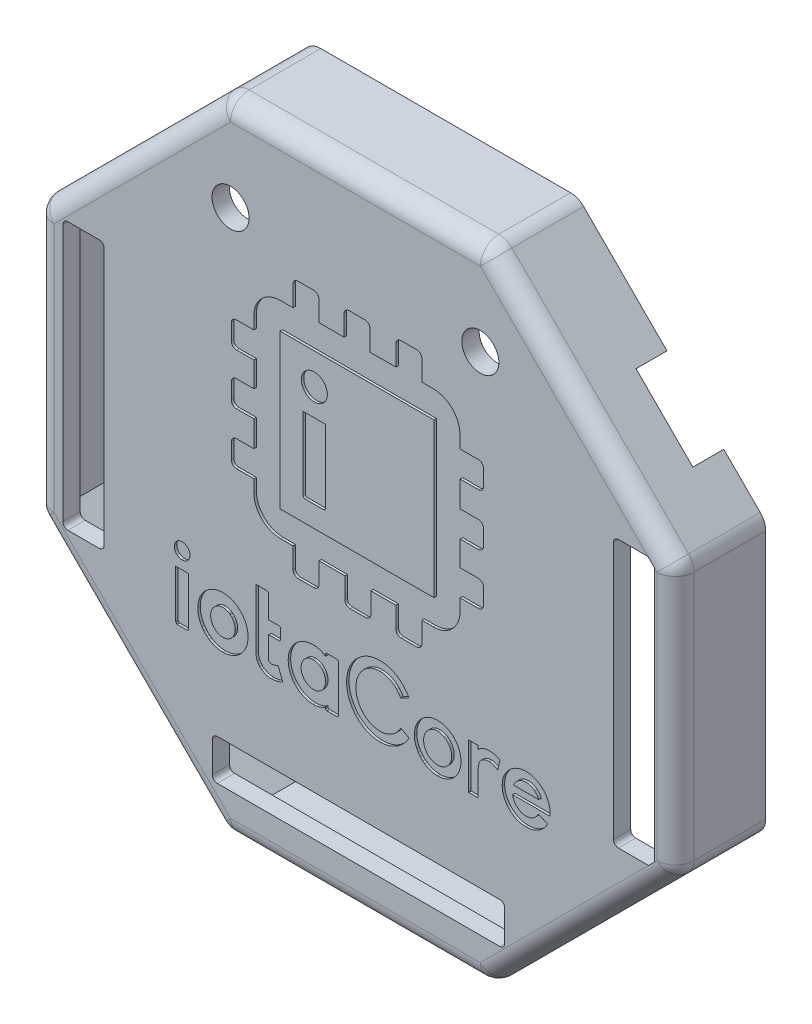
from build123d import *

# Parameters (mm, degrees)
BOSS_EXTRUDE1_DEPTH   = 5
BOSS_EXTRUDE1_2_DEPTH = 5
BOSS_EXTRUDE1_3_DEPTH = 5
BOSS_EXTRUDE1_4_DEPTH = 5
BOSS_EXTRUDE2_DEPTH   = 1.4
BOSS_EXTRUDE3_DEPTH   = 3.4
BOSS_EXTRUDE4_DEPTH   = 3.4
BOSS_EXTRUDE5_DEPTH   = 1
FILLET1_R             = 1.5
CUT_EXTRUDE1_DEPTH    = 38.183060659
CUT_EXTRUDE2_DEPTH    = 38.183060659
SKETCH10_W            = 12.459979079
SKETCH10_H            = 12.459974098
CUT_EXTRUDE3_DEPTH    = 0.2
SKETCH11_R            = 1.5
CUT_EXTRUDE4_DEPTH    = 38.183060659
BOSS_EXTRUDE6_START   = 0.9
BOSS_EXTRUDE6_DEPTH   = 0.9


with BuildPart() as part:
    # Sketch1 → Boss-Extrude1 (new body)
    with BuildSketch(Plane.XY):
        with BuildLine():
            ThreePointArc((25.460660172, -11.167471094), (25.785819299, -10.68083607), (25.9, -10.106810922))
            Line((25.9, -10.106810922), (25.9, 10.106810922))
            ThreePointArc((25.9, 10.106810922), (25.785819299, 10.68083607), (25.460660172, 11.167471094))
            Line((25.460660172, 11.167471094), (22.50588745, 14.122243815))
            Line((22.50588745, 14.122243815), (21.515937957, 13.132294321))
            Line((21.515937957, 13.132294321), (24.5, 10.148232278))
            Line((24.5, 10.148232278), (24.5, -10.148232278))
            Line((24.5, -10.148232278), (21.692714652, -12.955517626))
            Line((21.692714652, -12.955517626), (22.682664146, -13.94546712))
            Line((22.682664146, -13.94546712), (25.460660172, -11.167471094))
        make_face()
    extrude(amount=BOSS_EXTRUDE1_DEPTH)



with BuildPart() as body_2:
    # Sketch1 → Boss-Extrude1 2 (new body)
    with BuildSketch(Plane.XY):
        with BuildLine():
            Line((-15.187332265, -19.460900013), (-16.177281759, -20.450849507))
            Line((-16.177281759, -20.450849507), (-11.167471094, -25.460660172))
            ThreePointArc((-11.167471094, -25.460660172), (-10.68083607, -25.785819299), (-10.106810922, -25.9))
            Line((-10.106810922, -25.9), (10.106810922, -25.9))
            ThreePointArc((10.106810922, -25.9), (10.68083607, -25.785819299), (11.167471094, -25.460660172))
            Line((11.167471094, -25.460660172), (15.611596334, -21.016534932))
            Line((15.611596334, -21.016534932), (14.62164684, -20.026585438))
            Line((14.62164684, -20.026585438), (10.148232278, -24.5))
            Line((10.148232278, -24.5), (-10.148232278, -24.5))
            Line((-10.148232278, -24.5), (-15.187332265, -19.460900013))
        make_face()
    extrude(amount=BOSS_EXTRUDE1_2_DEPTH)


with BuildPart() as body_3:
    # Sketch1 → Boss-Extrude1 3 (new body)
    with BuildSketch(Plane.XY):
        with BuildLine():
            Line((-21.127029227, 13.521203051), (-22.116978721, 14.511152545))
            Line((-22.116978721, 14.511152545), (-25.460660172, 11.167471094))
            ThreePointArc((-25.460660172, 11.167471094), (-25.785819299, 10.68083607), (-25.9, 10.106810922))
            Line((-25.9, 10.106810922), (-25.9, -10.106810922))
            ThreePointArc((-25.9, -10.106810922), (-25.785819299, -10.68083607), (-25.460660172, -11.167471094))
            Line((-25.460660172, -11.167471094), (-22.187689399, -14.440441867))
            Line((-22.187689399, -14.440441867), (-21.197739905, -13.450492373))
            Line((-21.197739905, -13.450492373), (-24.5, -10.148232278))
            Line((-24.5, -10.148232278), (-24.5, 10.148232278))
            Line((-24.5, 10.148232278), (-21.127029227, 13.521203051))
        make_face()
    extrude(amount=BOSS_EXTRUDE1_3_DEPTH)


with BuildPart() as body_4:
    # Sketch1 → Boss-Extrude1 4 (new body)
    with BuildSketch(Plane.XY):
        with BuildLine():
            ThreePointArc((11.167471094, 25.460660172), (10.68083607, 25.785819299), (10.106810922, 25.9))
            Line((10.106810922, 25.9), (-10.106810922, 25.9))
            ThreePointArc((-10.106810922, 25.9), (-10.68083607, 25.785819299), (-11.167471094, 25.460660172))
            Line((-11.167471094, 25.460660172), (-17.520784643, 19.107346623))
            Line((-17.520784643, 19.107346623), (-16.530835149, 18.117397129))
            Line((-16.530835149, 18.117397129), (-10.148232278, 24.5))
            Line((-10.148232278, 24.5), (10.148232278, 24.5))
            Line((10.148232278, 24.5), (16.919743879, 17.728488399))
            Line((16.919743879, 17.728488399), (17.909693373, 18.718437893))
            Line((17.909693373, 18.718437893), (11.167471094, 25.460660172))
        make_face()
    extrude(amount=BOSS_EXTRUDE1_4_DEPTH)


with BuildPart() as part_1:
    add(part.part)

    add(body_2.part)  # Boss-Extrude2 merges body 2

    add(body_3.part)  # Boss-Extrude2 merges body 3

    add(body_4.part)  # Boss-Extrude2 merges body 4
    # Sketch2 → Boss-Extrude2 (add)
    with BuildSketch(Plane.XY.offset(5)):
        with BuildLine():
            Line((25.460660172, 11.167471094), (11.167471094, 25.460660172))
            ThreePointArc((11.167471094, 25.460660172), (10.68083607, 25.785819299), (10.106810922, 25.9))
            Line((10.106810922, 25.9), (-10.106810922, 25.9))
            ThreePointArc((-10.106810922, 25.9), (-10.68083607, 25.785819299), (-11.167471094, 25.460660172))
            Line((-11.167471094, 25.460660172), (-25.460660172, 11.167471094))
            ThreePointArc((-25.460660172, 11.167471094), (-25.785819299, 10.68083607), (-25.9, 10.106810922))
            Line((-25.9, 10.106810922), (-25.9, -10.106810922))
            ThreePointArc((-25.9, -10.106810922), (-25.785819299, -10.68083607), (-25.460660172, -11.167471094))
            Line((-25.460660172, -11.167471094), (-11.167471094, -25.460660172))
            ThreePointArc((-11.167471094, -25.460660172), (-10.68083607, -25.785819299), (-10.106810922, -25.9))
            Line((-10.106810922, -25.9), (10.106810922, -25.9))
            ThreePointArc((10.106810922, -25.9), (10.68083607, -25.785819299), (11.167471094, -25.460660172))
            Line((11.167471094, -25.460660172), (25.460660172, -11.167471094))
            ThreePointArc((25.460660172, -11.167471094), (25.785819299, -10.68083607), (25.9, -10.106810922))
            Line((25.9, -10.106810922), (25.9, 10.106810922))
            ThreePointArc((25.9, 10.106810922), (25.785819299, 10.68083607), (25.460660172, 11.167471094))
        make_face()
    extrude(amount=BOSS_EXTRUDE2_DEPTH)

    # Sketch3 → Boss-Extrude3 (add)
    with BuildSketch(Plane(origin=(0, 0, 5), x_dir=(-1, 0, 0), z_dir=(0, 0, -1))):
        Polygon((-21.515937957, 13.132294321), (-16.919743879, 17.728488399), (-17.909693373, 18.718437893), (-22.50588745, 14.122243815), align=None)
        Polygon((21.127029227, 13.521203051), (16.530835149, 18.117397129), (17.520784643, 19.107346623), (22.116978721, 14.511152545), align=None)
    extrude(amount=BOSS_EXTRUDE3_DEPTH)

    # Sketch4 → Boss-Extrude4 (add)
    with BuildSketch(Plane(origin=(0, 0, 5), x_dir=(-1, 0, 0), z_dir=(0, 0, -1))):
        Polygon((-15.611596334, -21.016534932), (-14.62164684, -20.026585438), (-21.692714652, -12.955517626), (-22.682664146, -13.94546712), align=None)
    extrude(amount=BOSS_EXTRUDE4_DEPTH)

    # Sketch5 → Boss-Extrude5 (add)
    with BuildSketch(Plane(origin=(0, 0, 5), x_dir=(-1, 0, 0), z_dir=(0, 0, -1))):
        Polygon((16.177281759, -20.450849507), (22.187689399, -14.440441867), (21.197739905, -13.450492373), (15.187332265, -19.460900013), align=None)
    extrude(amount=BOSS_EXTRUDE5_DEPTH)

    # Fillet1
    fillet1_edges = [part_1.edges().sort_by_distance(p)[0] for p in [
        (10.68083607, -25.785819299, 6.4),
        (0, -25.9, 6.4),
        (-10.68083607, -25.785819299, 6.4),
        (-18.314065633, -18.314065633, 6.4),
        (-25.785819299, -10.68083607, 6.4),
        (-25.9, 0, 6.4),
        (-25.785819299, 10.68083607, 6.4),
        (-18.314065633, 18.314065633, 6.4),
        (-10.68083607, 25.785819299, 6.4),
        (0, 25.9, 6.4),
        (10.68083607, 25.785819299, 6.4),
        (18.314065633, 18.314065633, 6.4),
        (25.785819299, 10.68083607, 6.4),
        (25.9, 0, 6.4),
        (25.785819299, -10.68083607, 6.4),
        (18.314065633, -18.314065633, 6.4),
        (15.116621587, -20.521560185, 1.6),
        (22.187689399, -13.450492373, 1.6),
    ]]
    fillet(fillet1_edges, radius=FILLET1_R)

    # Sketch6 → Cut-Extrude1 (cut, through all)
    with BuildSketch(Plane.XY.offset(6.4)):
        with BuildLine():
            ThreePointArc((-20.73285457, -10.793999535), (-20.450011859, -10.676842244), (-20.332854575, -10.39399953))
            Line((-20.332854575, -10.39399953), (-20.332854823, 10.43400047))
            ThreePointArc((-20.332854823, 10.43400047), (-20.450012114, 10.716843181), (-20.732854828, 10.834000465))
            Line((-20.732854828, 10.834000465), (-23.272854828, 10.834000435))
            ThreePointArc((-23.272854828, 10.834000435), (-23.555697539, 10.716843144), (-23.672854823, 10.43400043))
            Line((-23.672854823, 10.43400043), (-23.672854575, -10.39399957))
            ThreePointArc((-23.672854575, -10.39399957), (-23.555697284, -10.676842281), (-23.27285457, -10.793999565))
            Line((-23.27285457, -10.793999565), (-20.73285457, -10.793999535))
        make_face()
        with BuildLine():
            ThreePointArc((20.877947301, -10.389000462), (20.995104601, -10.671843169), (21.277947318, -10.789000444))
            Line((21.277947318, -10.789000444), (23.717810584, -10.789000338))
            Line((23.717810584, -10.789000338), (24.217947296, -10.288863626))
            Line((24.217947296, -10.288863626), (24.217946397, 10.288864525))
            Line((24.217946397, 10.288864525), (23.667811262, 10.83899966))
            Line((23.667811262, 10.83899966), (21.277946373, 10.838999556))
            ThreePointArc((21.277946373, 10.838999556), (20.995103665, 10.721842256), (20.87794639, 10.438999538))
            Line((20.87794639, 10.438999538), (20.877947301, -10.389000462))
        make_face()
    extrude(amount=-CUT_EXTRUDE1_DEPTH, mode=Mode.SUBTRACT)

    # Sketch7 → Cut-Extrude2 (cut, through all)
    with BuildSketch(Plane.XY.offset(6.4)):
        with BuildLine():
            ThreePointArc((11.677545073, -22.484597319), (11.960387765, -22.367439982), (12.077545003, -22.084597249))
            Line((12.077545003, -22.084597249), (12.077544568, -19.595397249))
            ThreePointArc((12.077544568, -19.595397249), (11.960387231, -19.312554557), (11.677544498, -19.195397319))
            Line((11.677544498, -19.195397319), (-11.182455502, -19.195401316))
            ThreePointArc((-11.182455502, -19.195401316), (-11.465298194, -19.312558653), (-11.582455432, -19.595401386))
            Line((-11.582455432, -19.595401386), (-11.582454997, -22.084601386))
            ThreePointArc((-11.582454997, -22.084601386), (-11.46529766, -22.367444078), (-11.182454927, -22.484601316))
            Line((-11.182454927, -22.484601316), (11.677545073, -22.484597319))
        make_face()
    extrude(amount=-CUT_EXTRUDE2_DEPTH, mode=Mode.SUBTRACT)

    # Sketch10 → Cut-Extrude3 (cut)
    # profile 1 of 12: a face of its own
    with BuildSketch(Plane.XY.offset(6.4)):
        with BuildLine():
            add(Edge.make_bspline(
                [(9.946665598, 8.667791407), (10.176801961, 8.667791407), (10.363683467, 8.853856031), (10.363683467, 9.083992394)],
                knots=[0, 0, 0, 0, 1, 1, 1, 1], degree=3))
            Line((10.363683467, 9.083992394), (10.363683467, 10.355453088))
            add(Edge.make_bspline(
                [(10.363683467, 10.355453088), (10.363683467, 10.585589451), (10.176801961, 10.771654075), (9.946665598, 10.771654075)],
                knots=[2, 2, 2, 2, 3, 3, 3, 3], degree=3))
            Line((9.946665598, 10.771654075), (8.467921292, 10.771654075))
            Line((8.467921292, 10.771654075), (8.467921292, 11.746058897))
            add(Edge.make_bspline(
                [(8.467921292, 11.746058897), (8.467921292, 12.942441232), (7.497595895, 13.912761649), (6.30040166, 13.912761649)],
                knots=[5, 5, 5, 5, 6, 6, 6, 6], degree=3))
            Line((6.30040166, 13.912761649), (5.37333112, 13.912761649))
            Line((5.37333112, 13.912761649), (5.37333112, 15.558807216))
            add(Edge.make_bspline(
                [(5.37333112, 15.558807216), (5.37333112, 15.788943579), (5.186444633, 15.975825084), (4.95630827, 15.975825084)],
                knots=[8, 8, 8, 8, 9, 9, 9, 9], degree=3))
            Line((4.95630827, 15.975825084), (3.685664458, 15.975825084))
            add(Edge.make_bspline(
                [(3.685664458, 15.975825084), (3.455533076, 15.975825084), (3.268646589, 15.788943579), (3.268646589, 15.558807216)],
                knots=[10, 10, 10, 10, 11, 11, 11, 11], degree=3))
            Line((3.268646589, 15.558807216), (3.268646589, 13.912761649))
            Line((3.268646589, 13.912761649), (1.174576534, 13.912761649))
            Line((1.174576534, 13.912761649), (1.174576534, 15.558807216))
            add(Edge.make_bspline(
                [(1.174576534, 15.558807216), (1.174576534, 15.788943579), (0.988506929, 15.975825084), (0.758370566, 15.975825084)],
                knots=[14, 14, 14, 14, 15, 15, 15, 15], degree=3))
            Line((0.758370566, 15.975825084), (-0.513085147, 15.975825084))
            add(Edge.make_bspline(
                [(-0.513085147, 15.975825084), (-0.74322151, 15.975825084), (-0.929291115, 15.788943579), (-0.929291115, 15.558807216)],
                knots=[16, 16, 16, 16, 17, 17, 17, 17], degree=3))
            Line((-0.929291115, 15.558807216), (-0.929291115, 13.912761649))
            Line((-0.929291115, 13.912761649), (-2.950728475, 13.912761649))
            Line((-2.950728475, 13.912761649), (-2.950728475, 15.558807216))
            add(Edge.make_bspline(
                [(-2.950728475, 15.558807216), (-2.950728475, 15.788943579), (-3.137614961, 15.975825084), (-3.367751324, 15.975825084)],
                knots=[20, 20, 20, 20, 21, 21, 21, 21], degree=3))
            Line((-3.367751324, 15.975825084), (-4.638395137, 15.975825084))
            add(Edge.make_bspline(
                [(-4.638395137, 15.975825084), (-4.868526519, 15.975825084), (-5.055413005, 15.788943579), (-5.055413005, 15.558807216)],
                knots=[22, 22, 22, 22, 23, 23, 23, 23], degree=3))
            Line((-5.055413005, 15.558807216), (-5.055413005, 13.912761649))
            Line((-5.055413005, 13.912761649), (-6.055116241, 13.912761649))
            add(Edge.make_bspline(
                [(-6.055116241, 13.912761649), (-7.252310476, 13.912761649), (-8.222635873, 12.942441232), (-8.222635873, 11.746058897)],
                knots=[25, 25, 25, 25, 26, 26, 26, 26], degree=3))
            Line((-8.222635873, 11.746058897), (-8.222635873, 10.771654075))
            Line((-8.222635873, 10.771654075), (-9.628747484, 10.771654075))
            add(Edge.make_bspline(
                [(-9.628747484, 10.771654075), (-9.858883847, 10.771654075), (-10.045765352, 10.585589451), (-10.045765352, 10.355453088)],
                knots=[28, 28, 28, 28, 29, 29, 29, 29], degree=3))
            Line((-10.045765352, 10.355453088), (-10.045765352, 9.083992394))
            add(Edge.make_bspline(
                [(-10.045765352, 9.083992394), (-10.045765352, 8.853856031), (-9.858883847, 8.667791407), (-9.628747484, 8.667791407)],
                knots=[30, 30, 30, 30, 31, 31, 31, 31], degree=3))
            Line((-9.628747484, 8.667791407), (-8.222635873, 8.667791407))
            Line((-8.222635873, 8.667791407), (-8.222635873, 6.646349066))
            Line((-8.222635873, 6.646349066), (-9.628747484, 6.646349066))
            add(Edge.make_bspline(
                [(-9.628747484, 6.646349066), (-9.858883847, 6.646349066), (-10.045765352, 6.459467561), (-10.045765352, 6.229331198)],
                knots=[34, 34, 34, 34, 35, 35, 35, 35], degree=3))
            Line((-10.045765352, 6.229331198), (-10.045765352, 4.958687385))
            add(Edge.make_bspline(
                [(-10.045765352, 4.958687385), (-10.045765352, 4.728551022), (-9.858883847, 4.541669517), (-9.628747484, 4.541669517)],
                knots=[36, 36, 36, 36, 37, 37, 37, 37], degree=3))
            Line((-9.628747484, 4.541669517), (-8.222635873, 4.541669517))
            Line((-8.222635873, 4.541669517), (-8.222635873, 2.44759448))
            Line((-8.222635873, 2.44759448), (-9.628747484, 2.44759448))
            add(Edge.make_bspline(
                [(-9.628747484, 2.44759448), (-9.858883847, 2.44759448), (-10.045765352, 2.261529856), (-10.045765352, 2.031393493)],
                knots=[40, 40, 40, 40, 41, 41, 41, 41], degree=3))
            Line((-10.045765352, 2.031393493), (-10.045765352, 0.759932799))
            add(Edge.make_bspline(
                [(-10.045765352, 0.759932799), (-10.045765352, 0.529796436), (-9.858883847, 0.343731812), (-9.628747484, 0.343731812)],
                knots=[42, 42, 42, 42, 43, 43, 43, 43], degree=3))
            Line((-9.628747484, 0.343731812), (-8.222635873, 0.343731812))
            Line((-8.222635873, 0.343731812), (-8.222635873, -0.609454022))
            add(Edge.make_bspline(
                [(-8.222635873, -0.609454022), (-8.222635873, -1.806653238), (-7.252310476, -2.776973655), (-6.055116241, -2.776973655)],
                knots=[45, 45, 45, 45, 46, 46, 46, 46], degree=3))
            Line((-6.055116241, -2.776973655), (-5.055413005, -2.776973655))
            Line((-5.055413005, -2.776973655), (-5.055413005, -4.443421329))
            add(Edge.make_bspline(
                [(-5.055413005, -4.443421329), (-5.055413005, -4.673557691), (-4.868526519, -4.860439197), (-4.638395137, -4.860439197)],
                knots=[48, 48, 48, 48, 49, 49, 49, 49], degree=3))
            Line((-4.638395137, -4.860439197), (-3.367751324, -4.860439197))
            add(Edge.make_bspline(
                [(-3.367751324, -4.860439197), (-3.137614961, -4.860439197), (-2.950728475, -4.673557691), (-2.950728475, -4.443421329)],
                knots=[50, 50, 50, 50, 51, 51, 51, 51], degree=3))
            Line((-2.950728475, -4.443421329), (-2.950728475, -2.776973655))
            Line((-2.950728475, -2.776973655), (-0.856658419, -2.776973655))
            Line((-0.856658419, -2.776973655), (-0.856658419, -4.443421329))
            add(Edge.make_bspline(
                [(-0.856658419, -4.443421329), (-0.856658419, -4.673557691), (-0.669776914, -4.860439197), (-0.439640551, -4.860439197)],
                knots=[54, 54, 54, 54, 55, 55, 55, 55], degree=3))
            Line((-0.439640551, -4.860439197), (0.831003261, -4.860439197))
            add(Edge.make_bspline(
                [(0.831003261, -4.860439197), (1.061139624, -4.860439197), (1.24802113, -4.673557691), (1.24802113, -4.443421329)],
                knots=[56, 56, 56, 56, 57, 57, 57, 57], degree=3))
            Line((1.24802113, -4.443421329), (1.24802113, -2.776973655))
            Line((1.24802113, -2.776973655), (3.268646589, -2.776973655))
            Line((3.268646589, -2.776973655), (3.268646589, -4.443421329))
            add(Edge.make_bspline(
                [(3.268646589, -4.443421329), (3.268646589, -4.673557691), (3.455533076, -4.860439197), (3.685664458, -4.860439197)],
                knots=[60, 60, 60, 60, 61, 61, 61, 61], degree=3))
            Line((3.685664458, -4.860439197), (4.95630827, -4.860439197))
            add(Edge.make_bspline(
                [(4.95630827, -4.860439197), (5.186444633, -4.860439197), (5.37333112, -4.673557691), (5.37333112, -4.443421329)],
                knots=[62, 62, 62, 62, 63, 63, 63, 63], degree=3))
            Line((5.37333112, -4.443421329), (5.37333112, -2.776973655))
            Line((5.37333112, -2.776973655), (6.30040166, -2.776973655))
            add(Edge.make_bspline(
                [(6.30040166, -2.776973655), (7.497595895, -2.776973655), (8.467921292, -1.806653238), (8.467921292, -0.609454022)],
                knots=[65, 65, 65, 65, 66, 66, 66, 66], degree=3))
            Line((8.467921292, -0.609454022), (8.467921292, 0.343731812))
            Line((8.467921292, 0.343731812), (9.946665598, 0.343731812))
            add(Edge.make_bspline(
                [(9.946665598, 0.343731812), (10.176801961, 0.343731812), (10.363683467, 0.529796436), (10.363683467, 0.759932799)],
                knots=[68, 68, 68, 68, 69, 69, 69, 69], degree=3))
            Line((10.363683467, 0.759932799), (10.363683467, 2.031393493))
            add(Edge.make_bspline(
                [(10.363683467, 2.031393493), (10.363683467, 2.261529856), (10.176801961, 2.44759448), (9.946665598, 2.44759448)],
                knots=[70, 70, 70, 70, 71, 71, 71, 71], degree=3))
            Line((9.946665598, 2.44759448), (8.467921292, 2.44759448))
            Line((8.467921292, 2.44759448), (8.467921292, 4.469036821))
            Line((8.467921292, 4.469036821), (9.946665598, 4.469036821))
            add(Edge.make_bspline(
                [(9.946665598, 4.469036821), (10.176801961, 4.469036821), (10.363683467, 4.655918326), (10.363683467, 4.886054689)],
                knots=[74, 74, 74, 74, 75, 75, 75, 75], degree=3))
            Line((10.363683467, 4.886054689), (10.363683467, 6.156698502))
            add(Edge.make_bspline(
                [(10.363683467, 6.156698502), (10.363683467, 6.386834865), (10.176801961, 6.57371637), (9.946665598, 6.57371637)],
                knots=[76, 76, 76, 76, 77, 77, 77, 77], degree=3))
            Line((9.946665598, 6.57371637), (8.467921292, 6.57371637))
            Line((8.467921292, 6.57371637), (8.467921292, 8.667791407))
            Line((8.467921292, 8.667791407), (9.946665598, 8.667791407))
        make_face()
        with Locations((0.12264271, 5.520968155)):
            Rectangle(SKETCH10_W, SKETCH10_H, mode=Mode.SUBTRACT)
    # profile 2 of 12: a face of its own
    with BuildSketch(Plane.XY.offset(6.4)):
        with BuildLine():
            Line((-2.412114846, 1.17858443), (-2.412114846, 7.057653747))
            Line((-2.412114846, 7.057653747), (-4.2458588, 7.057653747))
            Line((-4.2458588, 7.057653747), (-4.2458588, 1.17858443))
            add(Edge.make_bspline(
                [(-4.06386862, 0.996599231), (-4.164250373, 0.996599231), (-4.2458588, 1.078207659), (-4.2458588, 1.17858443)],
                knots=[3, 3, 3, 3, 4, 4, 4, 4], degree=3))
            Line((-4.06386862, 0.996599231), (-2.594916927, 0.996599231))
            add(Edge.make_bspline(
                [(-2.412114846, 1.17858443), (-2.412114846, 1.078207659), (-2.493723274, 0.996599231), (-2.594916927, 0.996599231)],
                knots=[1, 1, 1, 1, 2, 2, 2, 2], degree=3))
        make_face()
    # profile 3 of 12: a face of its own
    with BuildSketch(Plane.XY.offset(6.4)):
        Polygon((-13.49768684, -8.945545649), (-14.542354809, -8.945545649), (-14.542354809, -12.819764399), (-14.538487621, -12.882694087), (-14.454991527, -12.968123774), (-13.645870434, -12.968123774), (-13.582237621, -12.964256587), (-13.49768684, -12.879881587), align=None)
    # profile 4 of 12: a face of its own
    with BuildSketch(Plane.XY.offset(6.4)):
        with BuildLine():
            Line((-13.384835277, -7.620506587), (-13.384835277, -7.596951899))
            add(Edge.make_bspline(
                [(-13.577667309, -7.149412837), (-13.449698559, -7.280897212), (-13.384659496, -7.431365962), (-13.384835277, -7.596951899)],
                knots=[17, 17, 17, 17, 18, 18, 18, 18], degree=3))
            Line((-13.577667309, -7.149412837), (-13.586104809, -7.141326899))
            add(Edge.make_bspline(
                [(-14.004464184, -6.973280024), (-13.85487434, -6.973280024), (-13.71424934, -7.029881587), (-13.586104809, -7.141326899)],
                knots=[15, 15, 15, 15, 16, 16, 16, 16], degree=3))
            Line((-14.004464184, -6.973280024), (-14.035753246, -6.973280024))
            add(Edge.make_bspline(
                [(-14.38784309, -7.086834712), (-14.273409496, -7.011600337), (-14.154932934, -6.973280024), (-14.035753246, -6.973280024)],
                knots=[13, 13, 13, 13, 14, 14, 14, 14], degree=3))
            Line((-14.38784309, -7.086834712), (-14.461495434, -7.149061274))
            Line((-14.461495434, -7.149061274), (-14.472921215, -7.159959712))
            add(Edge.make_bspline(
                [(-14.655557934, -7.593084712), (-14.655557934, -7.436639399), (-14.594034496, -7.291092524), (-14.472921215, -7.159959712)],
                knots=[10, 10, 10, 10, 11, 11, 11, 11], degree=3))
            Line((-14.655557934, -7.593084712), (-14.655557934, -7.624373774))
            add(Edge.make_bspline(
                [(-14.601944652, -7.866248774), (-14.636925121, -7.786795649), (-14.655557934, -7.704178462), (-14.655557934, -7.624373774)],
                knots=[8, 8, 8, 8, 9, 9, 9, 9], degree=3))
            add(Edge.make_bspline(
                [(-14.463604809, -8.063123774), (-14.531456371, -7.991756587), (-14.576632152, -7.927420649), (-14.601944652, -7.866248774)],
                knots=[7, 7, 7, 7, 8, 8, 8, 8], degree=3))
            Line((-14.463604809, -8.063123774), (-14.456925121, -8.069803462))
            add(Edge.make_bspline(
                [(-14.031886059, -8.244178462), (-14.188331371, -8.244178462), (-14.331241527, -8.185467524), (-14.456925121, -8.069803462)],
                knots=[5, 5, 5, 5, 6, 6, 6, 6], degree=3))
            Line((-14.031886059, -8.244178462), (-14.008507152, -8.244178462))
            add(Edge.make_bspline(
                [(-13.56096809, -8.051170649), (-13.692276684, -8.179139399), (-13.842921215, -8.244178462), (-14.008507152, -8.244178462)],
                knots=[3, 3, 3, 3, 4, 4, 4, 4], degree=3))
            Line((-13.56096809, -8.051170649), (-13.552882152, -8.042733149))
            add(Edge.make_bspline(
                [(-13.384835277, -7.620506587), (-13.384835277, -7.772381587), (-13.441261059, -7.914412837), (-13.552882152, -8.042733149)],
                knots=[1, 1, 1, 1, 2, 2, 2, 2], degree=3))
        make_face()
    # profile 5 of 12: a face of its own
    with BuildSketch(Plane.XY.offset(6.4)):
        with BuildLine():
            Line((-10.740382152, -13.061639399), (-10.705225902, -13.061639399))
            add(Edge.make_bspline(
                [(-9.662139965, -12.759295649), (-9.994542309, -12.960389399), (-10.34487434, -13.061639399), (-10.705225902, -13.061639399)],
                knots=[4, 4, 4, 4, 5, 5, 5, 5], degree=3))
            add(Edge.make_bspline(
                [(-9.45331184, -12.607772212), (-9.523096996, -12.665076899), (-9.594815746, -12.717108149), (-9.662139965, -12.759295649)],
                knots=[3, 3, 3, 3, 4, 4, 4, 4], degree=3))
            add(Edge.make_bspline(
                [(-9.181554027, -12.337069087), (-9.294581371, -12.467498774), (-9.382120434, -12.554686274), (-9.45331184, -12.607772212)],
                knots=[2, 2, 2, 2, 3, 3, 3, 3], degree=3))
            add(Edge.make_bspline(
                [(-8.944425121, -11.990428462), (-9.004190746, -12.098709712), (-9.08346809, -12.214373774), (-9.181554027, -12.337069087)],
                knots=[1, 1, 1, 1, 2, 2, 2, 2], degree=3))
            add(Edge.make_bspline(
                [(-8.690069652, -10.980037837), (-8.690069652, -11.329490962), (-8.775675121, -11.669451899), (-8.944425121, -11.990428462)],
                knots=[0, 0, 0, 0, 1, 1, 1, 1], degree=3))
            add(Edge.make_bspline(
                [(-8.835089184, -10.202733149), (-8.739464184, -10.448475337), (-8.690421215, -10.711444087), (-8.690069652, -10.980037837)],
                knots=[24, 24, 24, 24, 25, 25, 25, 25], degree=3))
            add(Edge.make_bspline(
                [(-9.245538402, -9.539334712), (-9.054464184, -9.752381587), (-8.916475902, -9.975623774), (-8.835089184, -10.202733149)],
                knots=[23, 23, 23, 23, 24, 24, 24, 24], degree=3))
            Line((-9.245538402, -9.539334712), (-9.249581371, -9.535115962))
            add(Edge.make_bspline(
                [(-9.474757152, -9.326990962), (-9.421319652, -9.366365962), (-9.346612621, -9.435272212), (-9.249581371, -9.535115962)],
                knots=[21, 21, 21, 21, 22, 22, 22, 22], degree=3))
            add(Edge.make_bspline(
                [(-9.474757152, -9.326990962), (-9.84987434, -9.035194087), (-10.270518871, -8.887186274), (-11.132198559, -8.887186274), (-11.512237621, -9.005662837), (-11.849210277, -9.235936274)],
                knots=[20, 20, 20, 20, 21, 21, 21.896324952, 21.896324952, 21.896324952, 21.896324952], degree=3))
            add(Edge.make_bspline(
                [(-12.143819652, -9.478865962), (-12.006710277, -9.352655024), (-11.913194652, -9.275662837), (-11.849210277, -9.235936274)],
                knots=[18, 18, 18, 18, 19, 19, 19, 19], degree=3))
            Line((-12.143819652, -9.478865962), (-12.152432934, -9.487303462))
            add(Edge.make_bspline(
                [(-12.363897777, -9.740780024), (-12.314679027, -9.671522212), (-12.245948559, -9.588905024), (-12.152432934, -9.487303462)],
                knots=[16, 16, 16, 16, 17, 17, 17, 17], degree=3))
            add(Edge.make_bspline(
                [(-12.522276684, -10.004100337), (-12.477452465, -9.916912837), (-12.424366527, -9.829022212), (-12.363897777, -9.740780024)],
                knots=[15, 15, 15, 15, 16, 16, 16, 16], degree=3))
            add(Edge.make_bspline(
                [(-12.755538402, -10.945233149), (-12.755538402, -10.633045649), (-12.677139965, -10.316287837), (-12.522276684, -10.004100337)],
                knots=[14, 14, 14, 14, 15, 15, 15, 15], degree=3))
            Line((-12.755538402, -10.945233149), (-12.755538402, -11.003592524))
            add(Edge.make_bspline(
                [(-12.558839184, -11.871248774), (-12.689620434, -11.582264399), (-12.755538402, -11.290819087), (-12.755538402, -11.003592524)],
                knots=[12, 12, 12, 12, 13, 13, 13, 13], degree=3))
            add(Edge.make_bspline(
                [(-12.416983715, -12.129998774), (-12.472706371, -12.041053462), (-12.520167309, -11.954217524), (-12.558839184, -11.871248774)],
                knots=[11, 11, 11, 11, 12, 12, 12, 12], degree=3))
            add(Edge.make_bspline(
                [(-12.25596809, -12.345506587), (-12.31362434, -12.279061274), (-12.367764965, -12.206639399), (-12.416983715, -12.129998774)],
                knots=[10, 10, 10, 10, 11, 11, 11, 11], degree=3))
            add(Edge.make_bspline(
                [(-12.01831184, -12.583162837), (-12.126944652, -12.491405024), (-12.204815746, -12.413358149), (-12.25596809, -12.345506587)],
                knots=[9, 9, 9, 9, 10, 10, 10, 10], degree=3))
            add(Edge.make_bspline(
                [(-11.844112621, -12.720975337), (-11.908975902, -12.672459712), (-11.966983715, -12.626405024), (-12.01831184, -12.583162837)],
                knots=[8, 8, 8, 8, 9, 9, 9, 9], degree=3))
            Line((-11.844112621, -12.720975337), (-11.835323559, -12.726951899))
            add(Edge.make_bspline(
                [(-10.740382152, -13.061639399), (-11.120245434, -13.061639399), (-11.488682934, -12.949139399), (-11.835323559, -12.726951899)],
                knots=[6, 6, 6, 6, 7, 7, 7, 7], degree=3))
        make_face()
        with BuildLine():
            Line((-10.15503059, -10.127850337), (-10.13534309, -10.136287837))
            add(Edge.make_bspline(
                [(-10.004210277, -10.259686274), (-10.099659496, -10.158436274), (-10.131827465, -10.138045649), (-10.13534309, -10.136287837)],
                knots=[0, 0, 0, 0, 1, 1, 1, 1], degree=3))
            add(Edge.make_bspline(
                [(-9.731046215, -10.972303462), (-9.731046215, -10.706873774), (-9.82034309, -10.473787837), (-10.004210277, -10.259686274)],
                knots=[17, 17, 17, 17, 18, 18, 18, 18], degree=3))
            Line((-9.731046215, -10.972303462), (-9.731046215, -10.984256587))
            add(Edge.make_bspline(
                [(-9.874483715, -11.514061274), (-9.778682934, -11.340740962), (-9.731046215, -11.163553462), (-9.731046215, -10.984256587)],
                knots=[15, 15, 15, 15, 16, 16, 16, 16], degree=3))
            add(Edge.make_bspline(
                [(-10.038487621, -11.726756587), (-9.961143871, -11.644842524), (-9.90471809, -11.572069087), (-9.874483715, -11.514061274)],
                knots=[14, 14, 14, 14, 15, 15, 15, 15], degree=3))
            add(Edge.make_bspline(
                [(-10.038487621, -11.726756587), (-10.24081184, -11.924686274), (-10.465460277, -12.020662837), (-10.936202465, -12.020662837), (-11.126925121, -11.953865962), (-11.307979809, -11.816405024)],
                knots=[13, 13, 13, 13, 14, 14, 14.814363144, 14.814363144, 14.814363144, 14.814363144], degree=3))
            Line((-11.307979809, -11.816405024), (-11.317120434, -11.810076899))
            add(Edge.make_bspline(
                [(-11.469522777, -11.662069087), (-11.380753246, -11.761912837), (-11.335577465, -11.798123774), (-11.317120434, -11.810076899)],
                knots=[10, 10, 10, 10, 11, 11, 11, 11], degree=3))
            add(Edge.make_bspline(
                [(-11.469522777, -11.662069087), (-11.634581371, -11.454998774), (-11.714913402, -11.232108149), (-11.714913402, -10.746248774), (-11.649698559, -10.541639399), (-11.515753246, -10.354959712)],
                knots=[9, 9, 9, 9, 10, 10, 10.927475593, 10.927475593, 10.927475593, 10.927475593], degree=3))
            Line((-11.515753246, -10.354959712), (-11.505557934, -10.338436274))
            add(Edge.make_bspline(
                [(-11.384620434, -10.198865962), (-11.477081371, -10.291326899), (-11.500636059, -10.329295649), (-11.505557934, -10.338436274)],
                knots=[6, 6, 6, 6, 7, 7, 7, 7], degree=3))
            add(Edge.make_bspline(
                [(-11.384620434, -10.198865962), (-11.18159309, -10.016405024), (-10.965733715, -9.927811274), (-10.568116527, -9.927811274), (-10.413956371, -9.967889399), (-10.266827465, -10.046990962)],
                knots=[5, 5, 5, 5, 6, 6, 6.651094891, 6.651094891, 6.651094891, 6.651094891], degree=3))
            add(Edge.make_bspline(
                [(-10.165753246, -10.117303462), (-10.202139965, -10.087069087), (-10.236241527, -10.063514399), (-10.266827465, -10.046990962)],
                knots=[3, 3, 3, 3, 4, 4, 4, 4], degree=3))
            Line((-10.165753246, -10.117303462), (-10.15503059, -10.127850337))
        make_face(mode=Mode.SUBTRACT)
    # profile 6 of 12: a face of its own
    with BuildSketch(Plane.XY.offset(6.4)):
        with BuildLine():
            Line((-6.00378059, -12.793045649), (-5.873702465, -12.738201899))
            Line((-5.873702465, -12.738201899), (-6.263057934, -11.757342524))
            Line((-6.263057934, -11.757342524), (-6.427589184, -11.837498774))
            add(Edge.make_bspline(
                [(-6.427589184, -11.837498774), (-6.634659496, -11.911678462), (-6.746632152, -11.927147212), (-6.852628246, -11.927147212), (-6.899386059, -11.914842524), (-6.950362621, -11.887420649)],
                knots=[25, 25, 25, 25, 26, 26, 26.838414634, 26.838414634, 26.838414634, 26.838414634], degree=3))
            add(Edge.make_bspline(
                [(-7.018741527, -11.724295649), (-7.018741527, -11.853319087), (-6.970753246, -11.877225337), (-6.950362621, -11.887420649)],
                knots=[23, 23, 23, 23, 24, 24, 24, 24], degree=3))
            Line((-7.018741527, -11.724295649), (-7.018741527, -9.986522212))
            Line((-7.018741527, -9.986522212), (-6.195382152, -9.986522212))
            Line((-6.195382152, -9.986522212), (-6.131925121, -9.982655024))
            Line((-6.131925121, -9.982655024), (-6.04737434, -9.897928462))
            Line((-6.04737434, -9.897928462), (-6.04737434, -9.090037837))
            Line((-6.04737434, -9.090037837), (-6.051241527, -9.026053462))
            Line((-6.051241527, -9.026053462), (-6.136143871, -8.942030024))
            Line((-6.136143871, -8.942030024), (-7.018741527, -8.942030024))
            Line((-7.018741527, -8.942030024), (-7.018741527, -7.121287837))
            Line((-7.018741527, -7.121287837), (-7.022608715, -7.057655024))
            Line((-7.022608715, -7.057655024), (-7.107159496, -6.973280024))
            Line((-7.107159496, -6.973280024), (-8.059366527, -6.973280024))
            Line((-8.059366527, -6.973280024), (-8.059366527, -11.752069087))
            add(Edge.make_bspline(
                [(-7.941241527, -12.285740962), (-8.019639965, -12.108553462), (-8.059366527, -11.928905024), (-8.059366527, -11.752069087)],
                knots=[9, 9, 9, 9, 10, 10, 10, 10], degree=3))
            add(Edge.make_bspline(
                [(-7.826632152, -12.474881587), (-7.874971996, -12.411951899), (-7.91346809, -12.348319087), (-7.941241527, -12.285740962)],
                knots=[8, 8, 8, 8, 9, 9, 9, 9], degree=3))
            Line((-7.826632152, -12.474881587), (-7.760362621, -12.561365962))
            Line((-7.760362621, -12.561365962), (-7.745421215, -12.577889399))
            add(Edge.make_bspline(
                [(-7.58440559, -12.715701899), (-7.627823559, -12.684764399), (-7.680206371, -12.640115962), (-7.745421215, -12.577889399)],
                knots=[5, 5, 5, 5, 6, 6, 6, 6], degree=3))
            add(Edge.make_bspline(
                [(-6.80815559, -12.967772212), (-7.084659496, -12.967772212), (-7.345694652, -12.883045649), (-7.58440559, -12.715701899)],
                knots=[4, 4, 4, 4, 5, 5, 5, 5], degree=3))
            Line((-6.80815559, -12.967772212), (-6.800421215, -12.967772212))
            add(Edge.make_bspline(
                [(-6.32299934, -12.899569087), (-6.50299934, -12.945272212), (-6.66190559, -12.967772212), (-6.800421215, -12.967772212)],
                knots=[2, 2, 2, 2, 3, 3, 3, 3], degree=3))
            add(Edge.make_bspline(
                [(-6.00378059, -12.793045649), (-6.069522777, -12.820819087), (-6.17393684, -12.855623774), (-6.32299934, -12.899569087)],
                knots=[1, 1, 1, 1, 2, 2, 2, 2], degree=3))
        make_face()
    # profile 7 of 12: a face of its own
    with BuildSketch(Plane.XY.offset(6.4)):
        with BuildLine():
            Line((-1.377042309, -12.876014399), (-1.377042309, -9.038006587))
            Line((-1.377042309, -9.038006587), (-1.469151684, -8.945545649))
            Line((-1.469151684, -8.945545649), (-2.309034496, -8.945545649))
            Line((-2.309034496, -8.945545649), (-2.421534496, -9.020076899))
            Line((-2.421534496, -9.020076899), (-2.421534496, -9.203944087))
            add(Edge.make_bspline(
                [(-2.421534496, -9.203944087), (-2.704893871, -8.993358149), (-3.030089184, -8.887186274), (-3.887022777, -8.887186274), (-4.336495434, -9.053123774), (-4.734112621, -9.386405024)],
                knots=[11, 11, 11, 11, 12, 12, 13.367654201, 13.367654201, 13.367654201, 13.367654201], degree=3))
            add(Edge.make_bspline(
                [(-4.734112621, -9.386405024), (-5.203975902, -9.828319087), (-5.442159496, -10.361990962), (-5.442159496, -11.470115962), (-5.282022777, -11.921522212), (-4.962804027, -12.321951899)],
                knots=[9, 9, 9, 9, 10, 10, 10.803203661, 10.803203661, 10.803203661, 10.803203661], degree=3))
            add(Edge.make_bspline(
                [(-3.40362434, -13.061639399), (-4.01393684, -13.061639399), (-4.53846809, -12.812733149), (-4.962804027, -12.321951899)],
                knots=[7, 7, 7, 7, 8, 8, 8, 8], degree=3))
            Line((-3.40362434, -13.061639399), (-3.399757152, -13.061639399))
            add(Edge.make_bspline(
                [(-2.421534496, -12.761053462), (-2.696456371, -12.960740962), (-3.024112621, -13.061639399), (-3.399757152, -13.061639399)],
                knots=[5, 5, 5, 5, 6, 6, 6, 6], degree=3))
            Line((-2.421534496, -12.761053462), (-2.421534496, -12.893592524))
            Line((-2.421534496, -12.893592524), (-2.309034496, -12.968123774))
            Line((-2.309034496, -12.968123774), (-1.469151684, -12.968123774))
            Line((-1.469151684, -12.968123774), (-1.377042309, -12.876014399))
        make_face()
        with BuildLine():
            Line((-3.446690746, -9.931678462), (-3.384288402, -9.931678462))
            add(Edge.make_bspline(
                [(-2.887354809, -10.087069087), (-3.056807934, -9.984061274), (-3.224151684, -9.931678462), (-3.384288402, -9.931678462)],
                knots=[0, 0, 0, 0, 1, 1, 1, 1], degree=3))
            add(Edge.make_bspline(
                [(-2.887354809, -10.087069087), (-2.573761059, -10.314530024), (-2.421534496, -10.604217524), (-2.421534496, -11.275701899), (-2.526651684, -11.529530024), (-2.742511059, -11.752069087)],
                knots=[9, 9, 9, 9, 10, 10, 10.803588291, 10.803588291, 10.803588291, 10.803588291], degree=3))
            add(Edge.make_bspline(
                [(-3.368643871, -12.017147212), (-3.154542309, -12.017147212), (-2.949581371, -11.930311274), (-2.742511059, -11.752069087)],
                knots=[7, 7, 7, 7, 8, 8, 8, 8], degree=3))
            Line((-3.368643871, -12.017147212), (-3.454425121, -12.017147212))
            add(Edge.make_bspline(
                [(-3.93518684, -11.862108149), (-3.76362434, -11.964764399), (-3.60190559, -12.017147212), (-3.454425121, -12.017147212)],
                knots=[5, 5, 5, 5, 6, 6, 6, 6], degree=3))
            add(Edge.make_bspline(
                [(-3.93518684, -11.862108149), (-4.248956371, -11.626912837), (-4.401534496, -11.336170649), (-4.401534496, -10.740623774), (-4.328761059, -10.523709712), (-4.178819652, -10.309608149)],
                knots=[4, 4, 4, 4, 5, 5, 5.636714976, 5.636714976, 5.636714976, 5.636714976], degree=3))
            add(Edge.make_bspline(
                [(-3.446690746, -9.931678462), (-3.715460277, -9.931678462), (-3.95487434, -10.055428462), (-4.178819652, -10.309608149)],
                knots=[2, 2, 2, 2, 3, 3, 3, 3], degree=3))
        make_face(mode=Mode.SUBTRACT)
    # profile 8 of 12: a face of its own
    with BuildSketch(Plane.XY.offset(6.4)):
        with BuildLine():
            Line((4.333092679, -11.55291986), (4.333092679, -11.537099547))
            Line((4.333092679, -11.537099547), (3.674616116, -11.190458922))
            add(Edge.make_bspline(
                [(3.316022366, -11.677724547), (3.484772366, -11.490693297), (3.604303616, -11.328271422), (3.674616116, -11.190458922)],
                knots=[20, 20, 20, 20, 21, 21, 21, 21], degree=3))
            add(Edge.make_bspline(
                [(2.033522366, -12.242685485), (2.490905179, -12.242685485), (2.918405179, -12.054247985), (3.316022366, -11.677724547)],
                knots=[19, 19, 19, 19, 20, 20, 20, 20], degree=3))
            Line((2.033522366, -12.242685485), (1.951608304, -12.242685485))
            add(Edge.make_bspline(
                [(0.770709866, -11.79057611), (1.141959866, -12.092216735), (1.535709866, -12.242685485), (1.951608304, -12.242685485)],
                knots=[17, 17, 17, 17, 18, 18, 18, 18], degree=3))
            add(Edge.make_bspline(
                [(0.770709866, -11.79057611), (0.279752835, -11.336005797), (0.034010648, -10.78651361), (0.034010648, -9.585927672), (0.226315335, -9.090927672), (0.61092471, -8.656747985)],
                knots=[16, 16, 16, 16, 17, 17, 17.862050164, 17.862050164, 17.862050164, 17.862050164], degree=3))
            add(Edge.make_bspline(
                [(0.61092471, -8.656747985), (1.010827054, -8.246122985), (1.469616116, -8.041162047), (2.495827054, -8.041162047), (2.952155179, -8.243662047), (3.355045804, -8.64901361)],
                knots=[14, 14, 14, 14, 15, 15, 15.984364378, 15.984364378, 15.984364378, 15.984364378], degree=3))
            add(Edge.make_bspline(
                [(3.670748929, -9.089521422), (3.600436429, -8.962255797), (3.495319241, -8.815302672), (3.355045804, -8.64901361)],
                knots=[12, 12, 12, 12, 13, 13, 13, 13], degree=3))
            add(Edge.make_bspline(
                [(4.329225491, -8.727060485), (4.308483304, -8.745341735), (4.089108304, -8.865927672), (3.670748929, -9.089521422)],
                knots=[11, 11, 11, 11, 12, 12, 12, 12], degree=3))
            add(Edge.make_bspline(
                [(3.916139554, -8.150146422), (4.110905179, -8.373740172), (4.248717679, -8.565693297), (4.329225491, -8.727060485)],
                knots=[10, 10, 10, 10, 11, 11, 11, 11], degree=3))
            add(Edge.make_bspline(
                [(1.986764554, -7.292685485), (2.722233304, -7.292685485), (3.365241116, -7.578505797), (3.916139554, -8.150146422)],
                knots=[9, 9, 9, 9, 10, 10, 10, 10], degree=3))
            Line((1.986764554, -7.292685485), (1.979030179, -7.292685485))
            add(Edge.make_bspline(
                [(0.010807523, -8.196904235), (0.572252835, -7.593974547), (1.228092679, -7.292685485), (1.979030179, -7.292685485)],
                knots=[7, 7, 7, 7, 8, 8, 8, 8], degree=3))
            add(Edge.make_bspline(
                [(-0.714114352, -10.13401361), (-0.714114352, -9.414365172), (-0.472590915, -8.76854486), (0.010807523, -8.196904235)],
                knots=[6, 6, 6, 6, 7, 7, 7, 7], degree=3))
            Line((-0.714114352, -10.13401361), (-0.714114352, -10.157216735))
            add(Edge.make_bspline(
                [(-0.00079404, -12.086943297), (-0.476458102, -11.512490172), (-0.714114352, -10.86948236), (-0.714114352, -10.157216735)],
                knots=[4, 4, 4, 4, 5, 5, 5, 5], degree=3))
            add(Edge.make_bspline(
                [(-0.00079404, -12.086943297), (0.565573148, -12.69479486), (1.228092679, -12.998896422), (2.750709866, -12.998896422), (3.415866116, -12.689521422), (3.982233304, -12.071122985)],
                knots=[3, 3, 3, 3, 4, 4, 5.00695088, 5.00695088, 5.00695088, 5.00695088], degree=3))
            add(Edge.make_bspline(
                [(4.333092679, -11.55291986), (4.244850491, -11.716396422), (4.127780179, -11.889365172), (3.982233304, -12.071122985)],
                knots=[1, 1, 1, 1, 2, 2, 2, 2], degree=3))
        make_face()
    # profile 9 of 12: a face of its own
    with BuildSketch(Plane.XY.offset(6.4)):
        with BuildLine():
            Line((6.635827054, -13.043896422), (6.670983304, -13.043896422))
            add(Edge.make_bspline(
                [(7.637428616, -12.763349547), (7.328405179, -12.950380797), (7.006022366, -13.043896422), (6.670983304, -13.043896422)],
                knots=[4, 4, 4, 4, 5, 5, 5, 5], degree=3))
            add(Edge.make_bspline(
                [(7.836412991, -12.61885736), (7.766100491, -12.676162047), (7.700006741, -12.72432611), (7.637428616, -12.763349547)],
                knots=[3, 3, 3, 3, 4, 4, 4, 4], degree=3))
            add(Edge.make_bspline(
                [(8.081803616, -12.373466735), (7.980553616, -12.490537047), (7.898639554, -12.57245111), (7.836412991, -12.61885736)],
                knots=[2, 2, 2, 2, 3, 3, 3, 3], degree=3))
            add(Edge.make_bspline(
                [(8.303991116, -12.050029235), (8.249498929, -12.148818297), (8.175670804, -12.256396422), (8.081803616, -12.373466735)],
                knots=[1, 1, 1, 1, 2, 2, 2, 2], degree=3))
            add(Edge.make_bspline(
                [(8.541998929, -11.106787047), (8.541998929, -11.434091735), (8.462545804, -11.74838861), (8.303991116, -12.050029235)],
                knots=[0, 0, 0, 0, 1, 1, 1, 1], degree=3))
            add(Edge.make_bspline(
                [(8.405241116, -10.377646422), (8.496295804, -10.611787047), (8.541647366, -10.854716735), (8.541998929, -11.106787047)],
                knots=[21, 21, 21, 21, 22, 22, 22, 22], degree=3))
            add(Edge.make_bspline(
                [(8.023444241, -9.762060485), (8.202741116, -9.962099547), (8.330006741, -10.167412047), (8.405241116, -10.377646422)],
                knots=[20, 20, 20, 20, 21, 21, 21, 21], degree=3))
            add(Edge.make_bspline(
                [(7.812858304, -9.566943297), (7.862077054, -9.603505797), (7.932389554, -9.668193297), (8.023444241, -9.762060485)],
                knots=[19, 19, 19, 19, 20, 20, 20, 20], degree=3))
            add(Edge.make_bspline(
                [(7.812858304, -9.566943297), (7.462350491, -9.294130797), (7.074928616, -9.157724547), (6.271959866, -9.157724547), (5.922506741, -9.267060485), (5.602936429, -9.485029235)],
                knots=[18, 18, 18, 18, 19, 19, 19.895435685, 19.895435685, 19.895435685, 19.895435685], degree=3))
            add(Edge.make_bspline(
                [(5.330123929, -9.711435485), (5.457389554, -9.594365172), (5.548444241, -9.519130797), (5.602936429, -9.485029235)],
                knots=[16, 16, 16, 16, 17, 17, 17, 17], degree=3))
            add(Edge.make_bspline(
                [(5.131491116, -9.949091735), (5.175436429, -9.88651361), (5.241881741, -9.807412047), (5.330123929, -9.711435485)],
                knots=[15, 15, 15, 15, 16, 16, 16, 16], degree=3))
            add(Edge.make_bspline(
                [(4.983131741, -10.194833922), (5.024967679, -10.113974547), (5.074186429, -10.032412047), (5.131491116, -9.949091735)],
                knots=[14, 14, 14, 14, 15, 15, 15, 15], degree=3))
            add(Edge.make_bspline(
                [(4.764811429, -11.071630797), (4.764811429, -10.78088861), (4.837584866, -10.48838861), (4.983131741, -10.194833922)],
                knots=[13, 13, 13, 13, 14, 14, 14, 14], degree=3))
            Line((4.764811429, -11.071630797), (4.764811429, -11.129990172))
            add(Edge.make_bspline(
                [(4.948327054, -11.93682611), (4.825983304, -11.66682611), (4.764811429, -11.397529235), (4.764811429, -11.129990172)],
                knots=[11, 11, 11, 11, 12, 12, 12, 12], degree=3))
            add(Edge.make_bspline(
                [(5.080514554, -12.17870111), (5.028834866, -12.095380797), (4.984537991, -12.014872985), (4.948327054, -11.93682611)],
                knots=[10, 10, 10, 10, 11, 11, 11, 11], degree=3))
            add(Edge.make_bspline(
                [(5.232741116, -12.38120111), (5.178248929, -12.318974547), (5.127272366, -12.251474547), (5.080514554, -12.17870111)],
                knots=[9, 9, 9, 9, 10, 10, 10, 10], degree=3))
            add(Edge.make_bspline(
                [(5.451061429, -12.599521422), (5.349459866, -12.513740172), (5.276686429, -12.440966735), (5.232741116, -12.38120111)],
                knots=[8, 8, 8, 8, 9, 9, 9, 9], degree=3))
            add(Edge.make_bspline(
                [(5.618756741, -12.732060485), (5.556178616, -12.685302672), (5.500280179, -12.64135736), (5.451061429, -12.599521422)],
                knots=[7, 7, 7, 7, 8, 8, 8, 8], degree=3))
            add(Edge.make_bspline(
                [(6.635827054, -13.043896422), (6.282506741, -13.043896422), (5.943248929, -12.940185485), (5.618756741, -12.732060485)],
                knots=[6, 6, 6, 6, 7, 7, 7, 7], degree=3))
        make_face()
        with BuildLine():
            Line((7.789303616, -11.099052672), (7.789303616, -11.110654235))
            add(Edge.make_bspline(
                [(7.629694241, -11.706904235), (7.736217679, -11.514599547), (7.789303616, -11.315966735), (7.789303616, -11.110654235)],
                knots=[12, 12, 12, 12, 13, 13, 13, 13], degree=3))
            add(Edge.make_bspline(
                [(7.438795804, -11.95651361), (7.529498929, -11.860185485), (7.593131741, -11.776865172), (7.629694241, -11.706904235)],
                knots=[11, 11, 11, 11, 12, 12, 12, 12], degree=3))
            add(Edge.make_bspline(
                [(7.438795804, -11.95651361), (7.209928616, -12.179755797), (6.947662991, -12.291552672), (6.409772366, -12.291552672), (6.186178616, -12.213505797), (5.980866116, -12.057412047)],
                knots=[10, 10, 10, 10, 11, 11, 11.814946619, 11.814946619, 11.814946619, 11.814946619], degree=3))
            add(Edge.make_bspline(
                [(5.793834866, -11.878466735), (5.874342679, -11.96916986), (5.936569241, -12.028935485), (5.980866116, -12.057412047)],
                knots=[8, 8, 8, 8, 9, 9, 9, 9], degree=3))
            add(Edge.make_bspline(
                [(5.793834866, -11.878466735), (5.609264554, -11.64713861), (5.517155179, -11.38979486), (5.517155179, -10.84416986), (5.592389554, -10.607568297), (5.743209866, -10.397333922)],
                knots=[7, 7, 7, 7, 8, 8, 8.925558313, 8.925558313, 8.925558313, 8.925558313], degree=3))
            add(Edge.make_bspline(
                [(5.895084866, -10.218037047), (5.814577054, -10.29854486), (5.763952054, -10.358310485), (5.743209866, -10.397333922)],
                knots=[5, 5, 5, 5, 6, 6, 6, 6], degree=3))
            add(Edge.make_bspline(
                [(5.895084866, -10.218037047), (6.123952054, -10.012724547), (6.376022366, -9.910068297), (6.833053616, -9.910068297), (7.008483304, -9.95541986), (7.177584866, -10.046474547)],
                knots=[4, 4, 4, 4, 5, 5, 5.660280971, 5.660280971, 5.660280971, 5.660280971], degree=3))
            add(Edge.make_bspline(
                [(7.302389554, -10.132255797), (7.258092679, -10.095693297), (7.216608304, -10.067216735), (7.177584866, -10.046474547)],
                knots=[2, 2, 2, 2, 3, 3, 3, 3], degree=3))
            add(Edge.make_bspline(
                [(7.481686429, -10.292216735), (7.393092679, -10.198349547), (7.333678616, -10.14526361), (7.302389554, -10.132255797)],
                knots=[1, 1, 1, 1, 2, 2, 2, 2], degree=3))
            add(Edge.make_bspline(
                [(7.789303616, -11.099052672), (7.789303616, -10.800224547), (7.686998929, -10.531279235), (7.481686429, -10.292216735)],
                knots=[0, 0, 0, 0, 1, 1, 1, 1], degree=3))
        make_face(mode=Mode.SUBTRACT)
    # profile 10 of 12: a face of its own
    with BuildSketch(Plane.XY.offset(6.4)):
        with BuildLine():
            Line((11.693405179, -9.422802672), (11.693405179, -9.418935485))
            add(Edge.make_bspline(
                [(10.894303616, -9.192880797), (11.151295804, -9.192880797), (11.417780179, -9.268115172), (11.693405179, -9.418935485)],
                knots=[17, 17, 17, 17, 18, 18, 18, 18], degree=3))
            Line((10.894303616, -9.192880797), (10.796569241, -9.192880797))
            add(Edge.make_bspline(
                [(9.915905179, -9.555341735), (10.201725491, -9.313818297), (10.495280179, -9.192880797), (10.796569241, -9.192880797)],
                knots=[15, 15, 15, 15, 16, 16, 16, 16], degree=3))
            Line((9.915905179, -9.555341735), (9.915905179, -9.27479486))
            Line((9.915905179, -9.27479486), (9.908170804, -9.267060485))
            Line((9.908170804, -9.267060485), (9.179030179, -9.267060485))
            Line((9.179030179, -9.267060485), (9.167428616, -9.27479486))
            Line((9.167428616, -9.27479486), (9.167428616, -12.934912047))
            Line((9.167428616, -12.934912047), (9.179030179, -12.94651361))
            Line((9.179030179, -12.94651361), (9.908170804, -12.94651361))
            Line((9.908170804, -12.94651361), (9.915905179, -12.934912047))
            Line((9.915905179, -12.934912047), (9.915905179, -11.21963861))
            add(Edge.make_bspline(
                [(10.130358304, -10.22963861), (9.987272366, -10.403662047), (9.915905179, -10.733779235), (9.915905179, -11.21963861)],
                knots=[5, 5, 5, 5, 6, 6, 6, 6], degree=3))
            add(Edge.make_bspline(
                [(10.789186429, -9.952958922), (10.539577054, -9.952958922), (10.319850491, -10.045068297), (10.130358304, -10.22963861)],
                knots=[4, 4, 4, 4, 5, 5, 5, 5], degree=3))
            Line((10.789186429, -9.952958922), (10.851412991, -9.952958922))
            add(Edge.make_bspline(
                [(11.514108304, -10.198349547), (11.264498929, -10.034872985), (11.043717679, -9.952958922), (10.851412991, -9.952958922)],
                knots=[2, 2, 2, 2, 3, 3, 3, 3], degree=3))
            add(Edge.make_bspline(
                [(11.693405179, -9.422802672), (11.584069241, -9.916396422), (11.524303616, -10.175146422), (11.514108304, -10.198349547)],
                knots=[1, 1, 1, 1, 2, 2, 2, 2], degree=3))
        make_face()
    # profile 11 of 12: a face of its own
    with BuildSketch(Plane.XY.offset(6.4)):
        with BuildLine():
            Line((15.755358304, -11.219990172), (15.755358304, -11.10291986))
            add(Edge.make_bspline(
                [(15.446686429, -10.050341735), (15.652702054, -10.385380797), (15.755358304, -10.736240172), (15.755358304, -11.10291986)],
                knots=[19, 19, 19, 19, 20, 20, 20, 20], degree=3))
            add(Edge.make_bspline(
                [(15.062077054, -9.61370111), (15.248053616, -9.782802672), (15.376373929, -9.928349547), (15.446686429, -10.050341735)],
                knots=[18, 18, 18, 18, 19, 19, 19, 19], degree=3))
            add(Edge.make_bspline(
                [(13.874147366, -9.157724547), (14.285475491, -9.157724547), (14.681686429, -9.30995111), (15.062077054, -9.61370111)],
                knots=[17, 17, 17, 17, 18, 18, 18, 18], degree=3))
            Line((13.874147366, -9.157724547), (13.751452054, -9.157724547))
            add(Edge.make_bspline(
                [(12.631373929, -9.551474547), (13.003327054, -9.289208922), (13.376686429, -9.157724547), (13.751452054, -9.157724547)],
                knots=[15, 15, 15, 15, 16, 16, 16, 16], degree=3))
            add(Edge.make_bspline(
                [(11.874459866, -11.095185485), (11.874459866, -10.48698236), (12.126530179, -9.972646422), (12.631373929, -9.551474547)],
                knots=[14, 14, 14, 14, 15, 15, 15, 15], degree=3))
            Line((11.874459866, -11.095185485), (11.874459866, -11.110654235))
            add(Edge.make_bspline(
                [(12.305827054, -12.33057611), (12.018248929, -11.958974547), (11.874459866, -11.552568297), (11.874459866, -11.110654235)],
                knots=[12, 12, 12, 12, 13, 13, 13, 13], degree=3))
            add(Edge.make_bspline(
                [(13.802077054, -13.043896422), (13.221647366, -13.043896422), (12.722780179, -12.806240172), (12.305827054, -12.33057611)],
                knots=[11, 11, 11, 11, 12, 12, 12, 12], degree=3))
            Line((13.802077054, -13.043896422), (13.819303616, -13.043896422))
            add(Edge.make_bspline(
                [(15.286373929, -12.369599547), (14.871881741, -12.819247985), (14.382858304, -13.043896422), (13.819303616, -13.043896422)],
                knots=[9, 9, 9, 9, 10, 10, 10, 10], degree=3))
            add(Edge.make_bspline(
                [(15.552506741, -11.960380797), (15.513131741, -12.051435485), (15.424186429, -12.187841735), (15.286373929, -12.369599547)],
                knots=[8, 8, 8, 8, 9, 9, 9, 9], degree=3))
            add(Edge.make_bspline(
                [(14.817037991, -11.64854486), (15.301491116, -11.85104486), (15.546881741, -11.95510736), (15.552506741, -11.960380797)],
                knots=[7, 7, 7, 7, 8, 8, 8, 8], degree=3))
            add(Edge.make_bspline(
                [(14.732311429, -11.781083922), (14.780123929, -11.695302672), (14.808600491, -11.651005797), (14.817037991, -11.64854486)],
                knots=[6, 6, 6, 6, 7, 7, 7, 7], degree=3))
            add(Edge.make_bspline(
                [(14.732311429, -11.781083922), (14.484459866, -12.121396422), (14.177194241, -12.291552672), (13.520475491, -12.291552672), (13.261022366, -12.17870111), (13.032858304, -11.952646422)],
                knots=[5, 5, 5, 5, 6, 6, 6.792706334, 6.792706334, 6.792706334, 6.792706334], degree=3))
            add(Edge.make_bspline(
                [(12.711530179, -11.328974547), (12.776217679, -11.607060485), (12.883444241, -11.814833922), (13.032858304, -11.952646422)],
                knots=[3, 3, 3, 3, 4, 4, 4, 4], degree=3))
            Line((12.711530179, -11.328974547), (15.738483304, -11.328974547))
            add(Edge.make_bspline(
                [(15.755358304, -11.219990172), (15.755358304, -11.29276361), (15.749733304, -11.328974547), (15.738483304, -11.328974547)],
                knots=[1, 1, 1, 1, 2, 2, 2, 2], degree=3))
        make_face()
        with BuildLine():
            Line((12.787819241, -10.619521422), (12.855319241, -10.475380797))
            add(Edge.make_bspline(
                [(12.855319241, -10.475380797), (13.103170804, -10.098505797), (13.420280179, -9.910068297), (14.060123929, -9.910068297), (14.293912991, -9.994443297), (14.508366116, -10.16354486)],
                knots=[2, 2, 2, 2, 3, 3, 3.656050955, 3.656050955, 3.656050955, 3.656050955], degree=3))
            add(Edge.make_bspline(
                [(14.838131741, -10.615654235), (14.790319241, -10.483115172), (14.680280179, -10.33229486), (14.508366116, -10.16354486)],
                knots=[0, 0, 0, 0, 1, 1, 1, 1], degree=3))
            Line((14.838131741, -10.615654235), (14.838131741, -10.619521422))
            Line((14.838131741, -10.619521422), (12.787819241, -10.619521422))
        make_face(mode=Mode.SUBTRACT)
    # profile 12 of 12: a face of its own
    with BuildSketch(Plane.XY.offset(6.4)):
        with BuildLine():
            add(Edge.make_bspline(
                [(-4.381326598, 9.219465173), (-4.381326598, 8.638408587), (-3.910444378, 8.167531348), (-2.748341169, 8.167531348), (-2.276647049, 8.638408587), (-2.276647049, 9.800516778), (-2.748341169, 10.272210898), (-3.910444378, 10.272210898), (-4.381326598, 9.800516778), (-4.381326598, 9.219465173)],
                knots=[0, 0, 0, 0, 1, 1, 2, 2, 2.999991428, 2.999991428, 3.999982855, 3.999982855, 3.999982855, 3.999982855], degree=3))
        make_face()
    extrude(amount=-CUT_EXTRUDE3_DEPTH, mode=Mode.SUBTRACT)

    # Sketch11 → Cut-Extrude4 (cut, through all)
    with BuildSketch(Plane.XY.offset(6.4)):
        with Locations((-10.106810922, 18.4)):
            Circle(SKETCH11_R)
        with Locations((10.106810922, 18.4)):
            Circle(SKETCH11_R)
    extrude(amount=-CUT_EXTRUDE4_DEPTH, mode=Mode.SUBTRACT)

    # Sketch12 → Boss-Extrude6 (add)
    with BuildSketch(Plane(origin=(0, 0, 0), x_dir=(-1, 0, 0), z_dir=(0, 0, -1)).offset(BOSS_EXTRUDE6_START)):
        with BuildLine():
            Line((-25.25, 10.45889245), (-22.046268043, 13.662624407))
            Line((-22.046268043, 13.662624407), (-22.50588745, 14.122243815))
            Line((-22.50588745, 14.122243815), (-25.460660172, 11.167471094))
            ThreePointArc((-25.460660172, 11.167471094), (-25.785819299, 10.68083607), (-25.9, 10.106810922))
            Line((-25.9, 10.106810922), (-25.9, -10.106810922))
            ThreePointArc((-25.9, -10.106810922), (-25.785819299, -10.68083607), (-25.460660172, -11.167471094))
            Line((-25.460660172, -11.167471094), (-22.682664146, -13.94546712))
            Line((-22.682664146, -13.94546712), (-22.223044738, -13.485847712))
            Line((-22.223044738, -13.485847712), (-25.25, -10.45889245))
            Line((-25.25, -10.45889245), (-25.25, 10.45889245))
        make_face()
        with BuildLine():
            Line((-17.909693373, 18.718437893), (-17.450073965, 18.258818485))
            Line((-17.450073965, 18.258818485), (-10.45889245, 25.25))
            Line((-10.45889245, 25.25), (10.45889245, 25.25))
            Line((10.45889245, 25.25), (17.061165235, 18.647727215))
            Line((17.061165235, 18.647727215), (17.520784643, 19.107346623))
            Line((17.520784643, 19.107346623), (11.167471094, 25.460660172))
            ThreePointArc((11.167471094, 25.460660172), (10.68083607, 25.785819299), (10.106810922, 25.9))
            Line((10.106810922, 25.9), (-10.106810922, 25.9))
            ThreePointArc((-10.106810922, 25.9), (-10.68083607, 25.785819299), (-11.167471094, 25.460660172))
            Line((-11.167471094, 25.460660172), (-17.909693373, 18.718437893))
        make_face()
        with BuildLine():
            Line((-10.45889245, -25.25), (-15.151976926, -20.556915524))
            Line((-15.151976926, -20.556915524), (-15.611596334, -21.016534932))
            Line((-15.611596334, -21.016534932), (-11.167471094, -25.460660172))
            ThreePointArc((-11.167471094, -25.460660172), (-10.68083607, -25.785819299), (-10.106810922, -25.9))
            Line((-10.106810922, -25.9), (10.106810922, -25.9))
            ThreePointArc((10.106810922, -25.9), (10.68083607, -25.785819299), (11.167471094, -25.460660172))
            Line((11.167471094, -25.460660172), (16.177281759, -20.450849507))
            Line((16.177281759, -20.450849507), (15.717662351, -19.991230099))
            Line((15.717662351, -19.991230099), (10.45889245, -25.25))
            Line((10.45889245, -25.25), (-10.45889245, -25.25))
        make_face()
        with BuildLine():
            Line((22.116978721, 14.511152545), (21.657359313, 14.051533137))
            Line((21.657359313, 14.051533137), (25.25, 10.45889245))
            Line((25.25, 10.45889245), (25.25, -10.45889245))
            Line((25.25, -10.45889245), (21.728069991, -13.980822459))
            Line((21.728069991, -13.980822459), (22.187689399, -14.440441867))
            Line((22.187689399, -14.440441867), (25.460660172, -11.167471094))
            ThreePointArc((25.460660172, -11.167471094), (25.785819299, -10.68083607), (25.9, -10.106810922))
            Line((25.9, -10.106810922), (25.9, 10.106810922))
            ThreePointArc((25.9, 10.106810922), (25.785819299, 10.68083607), (25.460660172, 11.167471094))
            Line((25.460660172, 11.167471094), (22.116978721, 14.511152545))
        make_face()
    extrude(amount=-BOSS_EXTRUDE6_DEPTH)


solid = part_1.part
